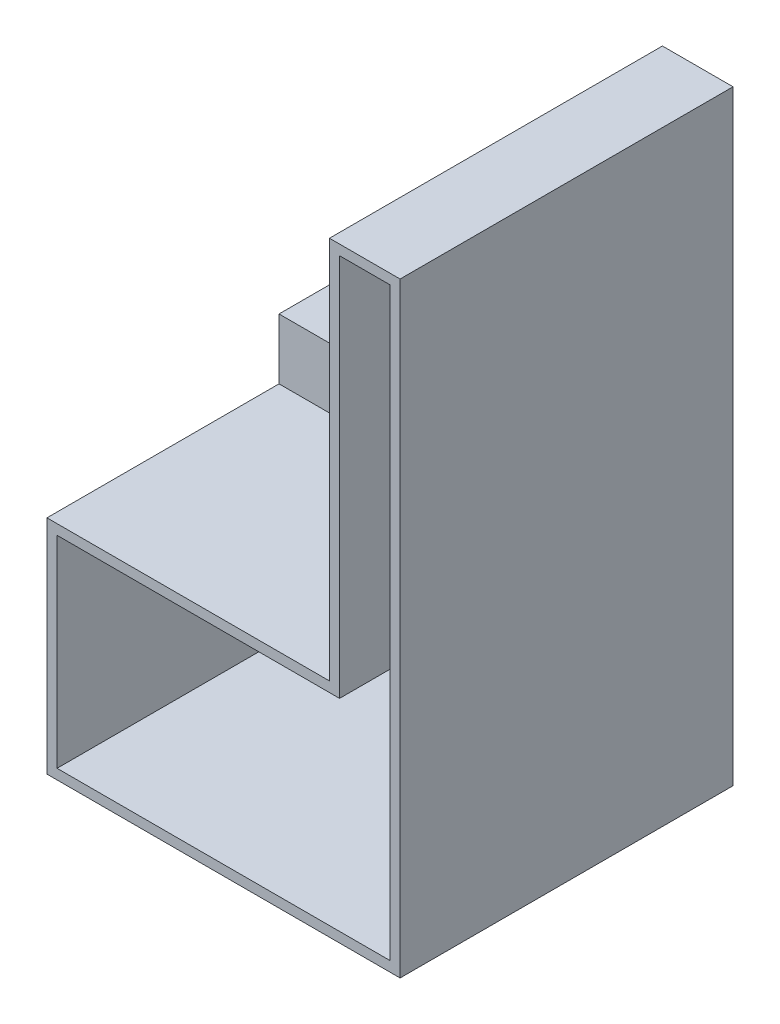
from build123d import *

# Parameters (mm, degrees)
EXTRUDE_1_DEPTH = 50
EXTRUDE_2_DEPTH = 115
SHELL_1_T       = -5


with BuildPart() as part:
    # ｽｹｯﾁ2 → ﾎﾞｽ - 押し出し1 (new body)
    with BuildSketch(Plane.XY):
        Polygon((0, 0), (0, 160), (35, 160), (35, -140), (-140, -140), (-140, 0), align=None)
    extrude(amount=EXTRUDE_1_DEPTH)

    # ｽｹｯﾁ3 → ﾎﾞｽ - 押し出し2 (add)
    with BuildSketch(Plane.XY.offset(50)):
        Polygon((-140, -30), (-140, -140), (35, -140), (35, 160), (0, 160), (0, -30), align=None)
    extrude(amount=EXTRUDE_2_DEPTH)

    # ｼｪﾙ1
    shell_1_openings = [part.faces().sort_by_distance(p)[0] for p in [
        (-34.527027027, -46.486486486, 165),
    ]]
    offset(amount=SHELL_1_T, openings=shell_1_openings, kind=Kind.INTERSECTION)


solid = part.part
